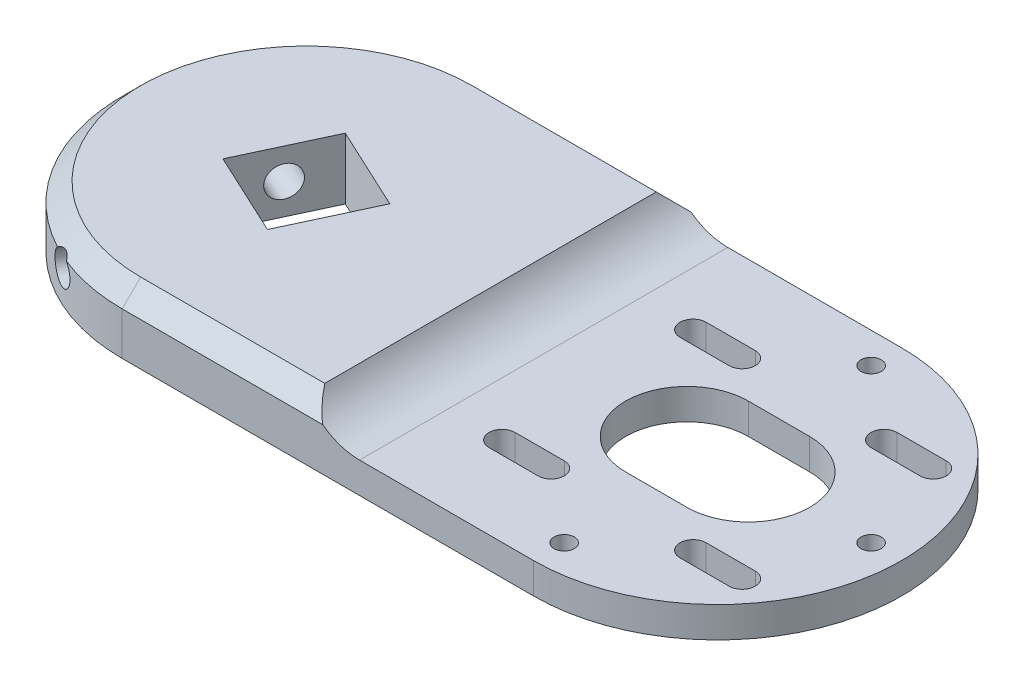
from build123d import *

# Parameters (mm, degrees)
BOSS_EXTRUDE1_DEPTH = 5
CUT_EXTRUDE1_DEPTH  = 71.407741052
BOSS_EXTRUDE2_DEPTH = 5
FILLET1_R           = 10
CUT_EXTRUDE2_DEPTH  = 71.938353519
M4_TAPPED_HOLE1_D   = 3.3
SKETCH13_W          = 2.5
SKETCH13_H          = 32.367781463
SKETCH14_W          = 2.5
SKETCH14_H          = 32.367781463
CHAMFER1_SIZE       = 3


with BuildPart() as part:
    # Sketch1 → Boss-Extrude1 (new body)
    with BuildSketch(Plane(origin=(0, 0, 0), x_dir=(1, 0, 0), z_dir=(0, 1, 0))):
        with BuildLine():
            Line((-33.5, 30), (33.5, 30))
            ThreePointArc((33.5, 30), (63.5, 0), (33.5, -30))
            Line((33.5, -30), (-33.5, -30))
            ThreePointArc((-33.5, -30), (-63.5, 0), (-33.5, 30))
        make_face()
        with BuildLine():
            Line((28.5, 10), (38.5, 10))
            ThreePointArc((38.5, 10), (48.5, 0), (38.5, -10))
            Line((38.5, -10), (28.5, -10))
            ThreePointArc((28.5, -10), (18.5, 0), (28.5, 10))
        make_face(mode=Mode.SUBTRACT)
    extrude(amount=BOSS_EXTRUDE1_DEPTH)

    # Sketch2 → Cut-Extrude1 (cut, through all)
    with BuildSketch(Plane(origin=(0, 5, 0), x_dir=(1, 0, 0), z_dir=(0, 1, 0))):
        with BuildLine():
            Line((13.943650814, 17.686349186), (21.943650814, 17.686349186))
            ThreePointArc((21.943650814, 17.686349186), (24.073650814, 15.556349186), (21.943650814, 13.426349186))
            Line((21.943650814, 13.426349186), (13.943650814, 13.426349186))
            ThreePointArc((13.943650814, 13.426349186), (11.813650814, 15.556349186), (13.943650814, 17.686349186))
        make_face()
        with BuildLine():
            Line((53.056349186, 17.686349186), (45.056349186, 17.686349186))
            ThreePointArc((45.056349186, 17.686349186), (42.926349186, 15.556349186), (45.056349186, 13.426349186))
            Line((45.056349186, 13.426349186), (53.056349186, 13.426349186))
            ThreePointArc((53.056349186, 13.426349186), (55.186349186, 15.556349186), (53.056349186, 17.686349186))
        make_face()
        with BuildLine():
            Line((53.056349186, -17.686349186), (45.056349186, -17.686349186))
            ThreePointArc((45.056349186, -17.686349186), (42.926349186, -15.556349186), (45.056349186, -13.426349186))
            Line((45.056349186, -13.426349186), (53.056349186, -13.426349186))
            ThreePointArc((53.056349186, -13.426349186), (55.186349186, -15.556349186), (53.056349186, -17.686349186))
        make_face()
        with BuildLine():
            Line((13.943650814, -17.686349186), (21.943650814, -17.686349186))
            ThreePointArc((21.943650814, -17.686349186), (24.073650814, -15.556349186), (21.943650814, -13.426349186))
            Line((21.943650814, -13.426349186), (13.943650814, -13.426349186))
            ThreePointArc((13.943650814, -13.426349186), (11.813650814, -15.556349186), (13.943650814, -17.686349186))
        make_face()
    extrude(amount=-CUT_EXTRUDE1_DEPTH, mode=Mode.SUBTRACT)

    # Sketch8 → Boss-Extrude2 (add)
    with BuildSketch(Plane(origin=(0, 5, 0), x_dir=(1, 0, 0), z_dir=(0, 1, 0))):
        with BuildLine():
            ThreePointArc((-33.5, -30), (-12.286796564, -21.213203436), (-3.5, 0))
            ThreePointArc((-3.5, 0), (-12.286796564, 21.213203436), (-33.5, 30))
            ThreePointArc((-33.5, 30), (-63.5, 0), (-33.5, -30))
        make_face()
        with BuildLine():
            Line((-3.5, 0), (-3.5, 30))
            Line((-3.5, 30), (-33.5, 30))
            ThreePointArc((-33.5, 30), (-12.286796564, 21.213203436), (-3.5, 0))
        make_face()
        with BuildLine():
            Line((-3.5, -30), (-3.5, 0))
            ThreePointArc((-3.5, 0), (-12.286796564, -21.213203436), (-33.5, -30))
            Line((-33.5, -30), (-3.5, -30))
        make_face()
    extrude(amount=BOSS_EXTRUDE2_DEPTH)

    # Fillet1
    # the kernel refuses this fillet: 10 mm, written as the material it adds along each edge
    with BuildSketch(Plane(origin=(-3.5, 5, -30), x_dir=(0, 1, 0), z_dir=(0, 0, 1))) as fillet1_piece_1:
        with BuildLine():
            CenterArc((10, -8.660254038), FILLET1_R, 120, 60)
            Line((0, -8.660254038), (-0.2, -8.660254038))
            Line((-0.2, -8.660254038), (-0.2, 0))
            Line((-0.2, 0), (0, 0.2))
            ThreePointArc((0, 0.2), (2.5, 0.2), (4.9, 0.173205081))
            Line((4.9, 0.173205081), (5, 0))
        make_face()
    extrude(amount=60)

    # Sketch9 → Cut-Extrude2 (cut, through all)
    with BuildSketch(Plane(origin=(0, 10, 0), x_dir=(1, 0, 0), z_dir=(0, 1, 0))):
        Polygon((-43.466945366, -3.62767144), (-37.12767144, 9.966945366), (-23.533054634, 3.62767144), (-29.87232856, -9.966945366), align=None)
    extrude(amount=-CUT_EXTRUDE2_DEPTH, mode=Mode.SUBTRACT)

    # M4 Tapped Hole1 (through all)
    with Locations(Plane(origin=(0, 5, 0), x_dir=(1, 0, 0), z_dir=(0, 1, 0))):
        with Locations((33.5, 25), (33.5, -25), (58.5, 0)):
            Hole(M4_TAPPED_HOLE1_D / 2)

    # Sketch13 → M6 Tapped Hole1 (revolve, cut)
    with BuildSketch(Plane(origin=(-40.297308403, 5, -3.169636963), x_dir=(0.4226182617407039, 0, -0.9063077870366479), z_dir=(0, 1, 0))):
        with Locations((1.25, 16.183890732)):
            Rectangle(SKETCH13_W, SKETCH13_H)
    revolve(axis=Axis((-34.542253955, 5, -0.486011001), (-0.9063077870366478, 0, -0.4226182617407039)), mode=Mode.SUBTRACT)

    # Sketch14 → M6 Tapped Hole2 (revolve, cut)
    with BuildSketch(Plane(origin=(-36.669636963, 5, 6.797308403), x_dir=(-0.9063077870366478, 0, -0.42261826174070416), z_dir=(0, 1, 0))):
        with Locations((1.25, 16.183890732)):
            Rectangle(SKETCH14_W, SKETCH14_H)
    revolve(axis=Axis((-33.986011001, 5, 1.042253955), (-0.4226182617407042, 0, 0.9063077870366477)), mode=Mode.SUBTRACT)

    # Chamfer1
    # the kernel refuses this chamfer: 3 mm, written as the material it takes off along each edge
    with BuildSketch(Plane(origin=(-33.5, 10, 30), x_dir=(0, 0.02749587661058619, -0.9996219169112968), z_dir=(1, 0, 0)), Plane(origin=(4.215048964, 10, -30), x_dir=(0, 0.02749587661058619, 0.9996219169112968), z_dir=(-1, 0, 0))) as chamfer1_piece_1:
        Polygon((CHAMFER1_SIZE * 0.999621916911, -CHAMFER1_SIZE * 0.0274958766106), (-CHAMFER1_SIZE * 0.0274958766106, -CHAMFER1_SIZE * 0.999621916911), (0, 0), align=None)
    extrude(amount=37.715048964, mode=Mode.SUBTRACT)
    with BuildSketch(Plane(origin=(-33.5, 10, 0), x_dir=(0, 0, 1), z_dir=(1, 0, 0))) as chamfer1_piece_2:
        Polygon((30 - CHAMFER1_SIZE, 0), (30, CHAMFER1_SIZE), (30, 0), align=None)
    revolve(axis=Axis((-33.5, 10, 0), (0, -1, 0)), revolution_arc=180, mode=Mode.SUBTRACT)


solid = part.part
